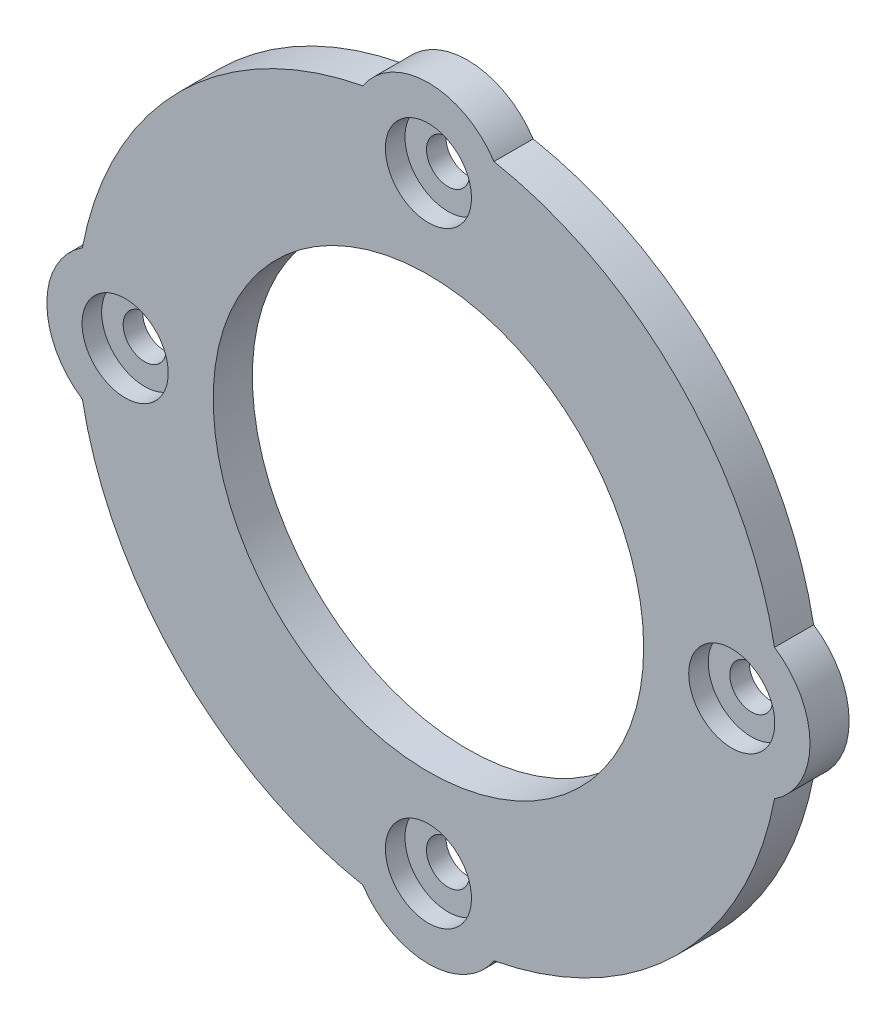
from build123d import *

# Parameters (mm, degrees)
EXTRUDE_1_DEPTH          = 2
SKETCH_2_R               = 11
CUT_EXTRUDE_1_DEPTH      = 28.649593125
SKETCH_3_R               = 2.2
CUT_EXTRUDE_2_DEPTH      = 1
SKETCH_4_R               = 1.1
CUT_EXTRUDE_3_DEPTH      = 28.595289453
PATTERN_CIRCULAR_1_COUNT = 4


with BuildPart() as part:
    # Эскиз1 → Бобышка-Вытянуть1 (new body)
    with BuildSketch(Plane.XY):
        with BuildLine():
            ThreePointArc((-17.685483871, -3.350173167), (-12.727922061, -12.727922061), (-3.350173167, -17.685483871))
            ThreePointArc((-3.350173167, -17.685483871), (0, -19.5), (3.350173167, -17.685483871))
            ThreePointArc((3.350173167, -17.685483871), (12.727922061, -12.727922061), (17.685483871, -3.350173167))
            ThreePointArc((17.685483871, -3.350173167), (19.5, 0), (17.685483871, 3.350173167))
            ThreePointArc((17.685483871, 3.350173167), (12.727922061, 12.727922061), (3.350173167, 17.685483871))
            ThreePointArc((3.350173167, 17.685483871), (0, 19.5), (-3.350173167, 17.685483871))
            ThreePointArc((-3.350173167, 17.685483871), (-12.727922061, 12.727922061), (-17.685483871, 3.350173167))
            ThreePointArc((-17.685483871, 3.350173167), (-19.5, 0), (-17.685483871, -3.350173167))
        make_face()
    extrude(amount=EXTRUDE_1_DEPTH)

    # Эскиз2 → Вырез-Вытянуть1 (cut, through all)
    with BuildSketch(Plane.XY.offset(2)):
        Circle(SKETCH_2_R)
    extrude(amount=-CUT_EXTRUDE_1_DEPTH, mode=Mode.SUBTRACT)

    # Эскиз3 → Вырез-Вытянуть2 (cut)
    with BuildSketch(Plane.XY.offset(2)):
        with Locations((-15.5, 0)):
            Circle(SKETCH_3_R)
    cut_extrude_2 = extrude(amount=-CUT_EXTRUDE_2_DEPTH, mode=Mode.SUBTRACT)

    # Эскиз4 → Вырез-Вытянуть3 (cut, through all)
    with BuildSketch(Plane.XY.offset(1)):
        with Locations((-15.5, 0)):
            Circle(SKETCH_4_R)
    cut_extrude_3 = extrude(amount=-CUT_EXTRUDE_3_DEPTH, mode=Mode.SUBTRACT)

    # Круговой массив1: Вырез-Вытянуть2, Вырез-Вытянуть3 ×4 about axis
    pattern_circular_1_axis = Axis((0, 0, 2), (0, 0, -1))
    add([cut_extrude_2.rotate(pattern_circular_1_axis, i * 360 / PATTERN_CIRCULAR_1_COUNT) for i in range(1, PATTERN_CIRCULAR_1_COUNT)], mode=Mode.SUBTRACT)
    add([cut_extrude_3.rotate(pattern_circular_1_axis, i * 360 / PATTERN_CIRCULAR_1_COUNT) for i in range(1, PATTERN_CIRCULAR_1_COUNT)], mode=Mode.SUBTRACT)


solid = part.part
